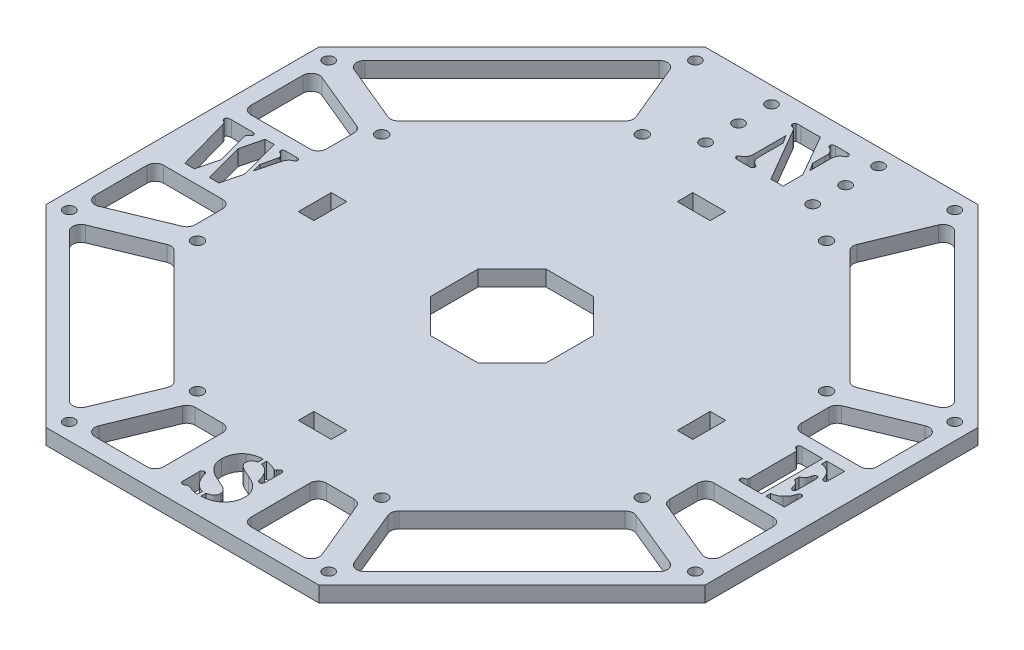
from build123d import *

# Parameters (mm, degrees)
BASE_DEPTH                   = 5.999988
SUPPORT_CUTOUTS_REACH        = 181.705
SKETCH4_W                    = 12.7
SKETCH4_H                    = 5.999988
SUPPORT_CUTOUT_PATTERN_COUNT = 4
F_8_CLEARANCE_HOLE1_D        = 4.4958
MOTOR_WIRE_HOLES_DEPTH       = 180.705313934
MOUNT_CLEARANCE_HOLES_D      = 4.3053
MOUNT_CLEARANCE_HOLES_DEPTH  = 6.35
F_8_CLEARANCE_HOLE2_D        = 4.3053
LIGHTENNING_1_DEPTH          = 180.705313934
DIRECTIONS_DEPTH             = 180.705313934
LIGHTENNING_2_DEPTH          = 180.705314078
LIGHTENNING_2_CIRC_PAT_COUNT = 3
LIGHTENNING_2_CIRC_PAT_ANGLE = 180


with BuildPart() as part:
    # Base sketch → Base (new body)
    with BuildSketch(Plane(origin=(0, 0, 0), x_dir=(1, 0, 0), z_dir=(0, 1, 0))):
        Polygon((-127, 52.605122421), (-127, -52.605122421), (-52.605122421, -127), (52.605122421, -127), (127, -52.605122421), (127, 52.605122421), (52.605122421, 127), (-52.605122421, 127), align=None)
    extrude(amount=BASE_DEPTH)

    # Sketch4 → Support cutouts (cut, up to next)
    with BuildSketch(Plane(origin=(0, 5.999988, 0), x_dir=(1, 0, 0), z_dir=(0, 1, 0)), mode=Mode.PRIVATE) as support_cutouts_sk1:
        with Locations((0, 73.025)):
            Rectangle(SKETCH4_W, SKETCH4_H)
    support_cutouts_tool1 = extrude(support_cutouts_sk1.sketch, amount=-SUPPORT_CUTOUTS_REACH, mode=Mode.PRIVATE) & part.part
    support_cutouts = support_cutouts_tool1.solids().sort_by_distance((0, 5.999988, -73.025))[0]
    add(support_cutouts, mode=Mode.SUBTRACT)

    # Support cutout pattern: Support cutouts ×4 about axis
    support_cutout_pattern_axis = Axis((0, -0.29972, 0), (0, 1, 0))
    for i in range(1, SUPPORT_CUTOUT_PATTERN_COUNT):
        add(support_cutouts.rotate(support_cutout_pattern_axis, i * 360 / SUPPORT_CUTOUT_PATTERN_COUNT), mode=Mode.SUBTRACT)

    # #8 Clearance Hole1 (through all)
    with Locations(Plane(origin=(0, 5.999988, 0), x_dir=(1, 0, 0), z_dir=(0, 1, 0))):
        with Locations((-85.725, 35.508457634), (-35.508457634, 85.725), (35.508457634, 85.725), (85.725, 35.508457634), (85.725, -35.508457634), (35.508457634, -85.725), (-35.508457634, -85.725), (-85.725, -35.508457634)):
            Hole(F_8_CLEARANCE_HOLE1_D / 2)

    # Sketch29 → Motor wire holes (cut, through all)
    with BuildSketch(Plane(origin=(0, 5.999988, 0), x_dir=(1, 0, 0), z_dir=(0, 1, 0))):
        Polygon((-22.225, -9.205896424), (-9.205896424, -22.225), (9.205896424, -22.225), (22.225, -9.205896424), (22.225, 9.205896424), (9.205896424, 22.225), (-9.205896424, 22.225), (-22.225, 9.205896424), align=None)
    extrude(amount=-MOTOR_WIRE_HOLES_DEPTH, mode=Mode.SUBTRACT)

    # mount clearance holes
    with Locations(Plane(origin=(0, 5.999988, 0), x_dir=(1, 0, 0), z_dir=(0, 1, 0))):
        with Locations((-120.65, 49.9748663), (-49.9748663, 120.65), (49.9748663, 120.65), (120.65, 49.9748663), (120.65, -49.9748663), (49.9748663, -120.65), (-49.9748663, -120.65), (-120.65, -49.9748663)):
            Hole(MOUNT_CLEARANCE_HOLES_D / 2, depth=MOUNT_CLEARANCE_HOLES_DEPTH)

    # #8 Clearance Hole2 (through all)
    with Locations(Plane(origin=(0, 5.999988, 0), x_dir=(1, 0, 0), z_dir=(0, 1, 0))):
        with Locations((20.6375, 95.25), (20.6375, 107.95), (20.6375, 120.65), (-20.6375, 120.65), (-20.6375, 107.95), (-20.6375, 95.25)):
            Hole(F_8_CLEARANCE_HOLE2_D / 2)

    # Sketch36 → Lightenning 1 (cut, through all)
    with BuildSketch(Plane(origin=(0, 5.999988, 0), x_dir=(1, 0, 0), z_dir=(0, 1, 0))):
        with BuildLine():
            Line((-112.614920409, 51.801520213), (-90.389920409, 42.595623789))
            ThreePointArc((-90.389920409, 42.595623789), (-88.555488739, 42.41494804), (-86.929836481, 43.283877275))
            Line((-86.929836481, 43.283877275), (-43.283877275, 86.929836481))
            ThreePointArc((-43.283877275, 86.929836481), (-42.41494804, 88.555488739), (-42.595623789, 90.389920409))
            Line((-42.595623789, 90.389920409), (-51.801520213, 112.614920409))
            ThreePointArc((-51.801520213, 112.614920409), (-54.115425956, 114.513893776), (-56.979901759, 113.644964541))
            Line((-56.979901759, 113.644964541), (-113.644964541, 56.979901759))
            ThreePointArc((-113.644964541, 56.979901759), (-114.513893776, 54.115425956), (-112.614920409, 51.801520213))
        make_face()
        with BuildLine():
            Line((56.979901759, 113.644964541), (113.644964541, 56.979901759))
            ThreePointArc((113.644964541, 56.979901759), (114.513893776, 54.115425956), (112.614920409, 51.801520213))
            Line((112.614920409, 51.801520213), (90.389920409, 42.595623789))
            ThreePointArc((90.389920409, 42.595623789), (88.555488739, 42.41494804), (86.929836481, 43.283877275))
            Line((86.929836481, 43.283877275), (43.283877275, 86.929836481))
            ThreePointArc((43.283877275, 86.929836481), (42.41494804, 88.555488739), (42.595623789, 90.389920409))
            Line((42.595623789, 90.389920409), (51.801520213, 112.614920409))
            ThreePointArc((51.801520213, 112.614920409), (54.115425956, 114.513893776), (56.979901759, 113.644964541))
        make_face()
        with BuildLine():
            Line((113.644964541, -56.979901759), (56.979901759, -113.644964541))
            ThreePointArc((56.979901759, -113.644964541), (54.115425956, -114.513893776), (51.801520213, -112.614920409))
            Line((51.801520213, -112.614920409), (42.595623789, -90.389920409))
            ThreePointArc((42.595623789, -90.389920409), (42.41494804, -88.555488739), (43.283877275, -86.929836481))
            Line((43.283877275, -86.929836481), (86.929836481, -43.283877275))
            ThreePointArc((86.929836481, -43.283877275), (88.555488739, -42.41494804), (90.389920409, -42.595623789))
            Line((90.389920409, -42.595623789), (112.614920409, -51.801520213))
            ThreePointArc((112.614920409, -51.801520213), (114.513893776, -54.115425956), (113.644964541, -56.979901759))
        make_face()
        with BuildLine():
            Line((-56.979901759, -113.644964541), (-113.644964541, -56.979901759))
            ThreePointArc((-113.644964541, -56.979901759), (-114.513893776, -54.115425956), (-112.614920409, -51.801520213))
            Line((-112.614920409, -51.801520213), (-90.389920409, -42.595623789))
            ThreePointArc((-90.389920409, -42.595623789), (-88.555488739, -42.41494804), (-86.929836481, -43.283877275))
            Line((-86.929836481, -43.283877275), (-43.283877275, -86.929836481))
            ThreePointArc((-43.283877275, -86.929836481), (-42.41494804, -88.555488739), (-42.595623789, -90.389920409))
            Line((-42.595623789, -90.389920409), (-51.801520213, -112.614920409))
            ThreePointArc((-51.801520213, -112.614920409), (-54.115425956, -114.513893776), (-56.979901759, -113.644964541))
        make_face()
    extrude(amount=-LIGHTENNING_1_DEPTH, mode=Mode.SUBTRACT)

    # Sketch37 → Directions (cut, through all)
    with BuildSketch(Plane(origin=(0, 5.999988, 0), x_dir=(1, 0, 0), z_dir=(0, 1, 0))):
        with BuildLine():
            Line((-0.263655027, 119.115560665), (8.895510373, 103.159733252))
            Line((8.895510373, 103.159733252), (8.895510373, 95.602783972))
            Line((8.895510373, 95.602783972), (4.196016594, 95.602783972))
            Line((4.196016594, 95.602783972), (-7.565474351, 115.758050452))
            add(Edge.make_bspline(
                [(-7.565474351, 115.758050452), (-7.626545799, 115.858484028), (-7.740071239, 116.045179551), (-7.898822848, 116.301319094), (-8.049204258, 116.502903942), (-8.222803652, 116.707787914), (-8.466187591, 116.913139143), (-8.696438169, 117.002669141), (-8.815611133, 117.049008026)],
                knots=[0, 0, 0, 0, 1.148206832, 2.134396517, 2.941784819, 3.601293645, 4.758478929, 6, 6, 6, 6], degree=3))
            Line((-8.815611133, 117.049008026), (-9.473846418, 117.288830184))
            add(Edge.make_bspline(
                [(-9.473846418, 117.288830184), (-9.55527066, 117.324691169), (-9.717709786, 117.396232848), (-9.904505623, 117.592550574), (-10.019149579, 117.836024562), (-10.036623424, 118.012257311), (-10.045337518, 118.100143443)],
                knots=[0, 0, 0, 0, 1.002473422, 1.999906911, 3.00256651, 4, 4, 4, 4], degree=3))
            add(Edge.make_bspline(
                [(-10.045337518, 118.100143443), (-10.037149376, 118.195015854), (-10.020718931, 118.385388219), (-9.897734175, 118.647272373), (-9.71184523, 118.871275333), (-9.539105479, 118.952710769), (-9.453436021, 118.993098287)],
                knots=[0, 0, 0, 0, 0.998849935, 2.004306838, 3.010245474, 4, 4, 4, 4], degree=3))
            add(Edge.make_bspline(
                [(-9.453436021, 118.993098287), (-9.382409116, 119.013998559), (-9.199550463, 119.067806278), (-8.849403273, 119.086590792), (-8.374085078, 119.118367463), (-8.012973394, 119.116569356), (-7.810399108, 119.115560665)],
                knots=[0, 0, 0, 0, 0.536148819, 1.380314255, 2.53042427, 4, 4, 4, 4], degree=3))
            Line((-7.810399108, 119.115560665), (-0.263655027, 119.115560665))
        make_face()
        with BuildLine():
            Line((-7.432806774, 112.977133937), (-5.473408717, 109.961497864))
            Line((-5.473408717, 109.961497864), (-5.473408717, 100.776819469))
            add(Edge.make_bspline(
                [(-5.473408717, 100.776819469), (-5.469055935, 100.586021928), (-5.460700363, 100.21976823), (-5.382728119, 99.6981249), (-5.262710119, 99.227406629), (-5.089068936, 98.805729823), (-4.85213913, 98.431592131), (-4.564343169, 98.090725132), (-4.214003136, 97.787147282), (-3.946837055, 97.621522578), (-3.809961407, 97.536669035)],
                knots=[0, 0, 0, 0, 1.190721145, 2.285700438, 3.285246989, 4.21825195, 5.120024924, 6.039327733, 6.995500152, 8, 8, 8, 8], degree=3))
            Line((-3.809961407, 97.536669035), (-3.299701496, 97.245820885))
            add(Edge.make_bspline(
                [(-3.299701496, 97.245820885), (-3.231857884, 97.201860435), (-3.100479182, 97.116731315), (-2.959354433, 96.929548908), (-2.872470899, 96.712152954), (-2.86483304, 96.556123983), (-2.860877973, 96.47532842)],
                knots=[0, 0, 0, 0, 1.033525086, 2.00141443, 2.965084209, 4, 4, 4, 4], degree=3))
            add(Edge.make_bspline(
                [(-2.860877973, 96.47532842), (-2.864956803, 96.411995733), (-2.872848076, 96.28946659), (-2.93060722, 96.112330477), (-3.036684603, 95.957436924), (-3.129500678, 95.871499071), (-3.177239118, 95.827298333)],
                knots=[0, 0, 0, 0, 1.017932389, 1.969384057, 2.955585702, 4, 4, 4, 4], degree=3))
            add(Edge.make_bspline(
                [(-3.177239118, 95.827298333), (-3.232072148, 95.792158738), (-3.358904473, 95.710878595), (-3.60964788, 95.649789644), (-3.924156844, 95.610370207), (-4.156704558, 95.605474468), (-4.284503124, 95.602783972)],
                knots=[0, 0, 0, 0, 0.677978509, 1.568207904, 2.663588058, 4, 4, 4, 4], degree=3))
            Line((-4.284503124, 95.602783972), (-8.397198006, 95.602783972))
            add(Edge.make_bspline(
                [(-8.397198006, 95.602783972), (-8.526583167, 95.6057372), (-8.7673749, 95.611233293), (-9.104615381, 95.650410986), (-9.390388373, 95.718713479), (-9.626206962, 95.817067881), (-9.817639262, 95.936422178), (-9.951644061, 96.097510927), (-10.032074991, 96.288123463), (-10.040832926, 96.425222666), (-10.045337518, 96.495738816)],
                knots=[0, 0, 0, 0, 1.481402756, 2.756958638, 3.881237287, 4.832623133, 5.67532584, 6.435925958, 7.195527913, 8, 8, 8, 8], degree=3))
            add(Edge.make_bspline(
                [(-10.045337518, 96.495738816), (-10.040152027, 96.59001324), (-10.030404998, 96.767218379), (-9.903412197, 96.961501544), (-9.760252857, 97.097334013), (-9.59197636, 97.203111948), (-9.385634761, 97.33974442), (-9.224767325, 97.424262529), (-9.137074877, 97.470335246)],
                knots=[0, 0, 0, 0, 1.181703852, 2.22121744, 2.84898449, 3.689607338, 4.740553118, 6, 6, 6, 6], degree=3))
            add(Edge.make_bspline(
                [(-9.137074877, 97.470335246), (-9.001741347, 97.549749907), (-8.735097603, 97.706218319), (-8.383480555, 98.008009414), (-8.08712602, 98.356551203), (-7.8415043, 98.750980375), (-7.66103498, 99.1938922), (-7.527667687, 99.680178882), (-7.444771772, 100.212710799), (-7.436890013, 100.584308772), (-7.432806774, 100.776819469)],
                knots=[0, 0, 0, 0, 0.957876818, 1.887277031, 2.816677243, 3.745902915, 4.715393506, 5.729584291, 6.823784461, 8, 8, 8, 8], degree=3))
            Line((-7.432806774, 100.776819469), (-7.432806774, 112.977133937))
        make_face()
        with BuildLine():
            Line((8.895510373, 105.899828974), (6.936112316, 108.971593637))
            Line((6.936112316, 108.971593637), (6.936112316, 113.727216006))
            add(Edge.make_bspline(
                [(6.936112316, 113.727216006), (6.932370616, 113.958808382), (6.925354947, 114.393043082), (6.844437365, 115.002740085), (6.71114161, 115.525534451), (6.518028543, 115.977300644), (6.246621586, 116.364743581), (5.901854431, 116.717183716), (5.473651649, 117.039234765), (5.147590907, 117.219744535), (4.976714258, 117.31434318)],
                knots=[0, 0, 0, 0, 1.271815313, 2.384648193, 3.370695924, 4.228477648, 5.068356943, 5.953941433, 6.927734667, 8, 8, 8, 8], degree=3))
            add(Edge.make_bspline(
                [(4.976714258, 117.31434318), (4.868164473, 117.368374875), (4.676595176, 117.463730326), (4.449027176, 117.669039397), (4.342163456, 117.929734698), (4.330013976, 118.11121522), (4.323581572, 118.207298024)],
                knots=[0, 0, 0, 0, 1.226241823, 2.164078746, 3.027992319, 4, 4, 4, 4], degree=3))
            add(Edge.make_bspline(
                [(4.323581572, 118.207298024), (4.326975856, 118.280925883), (4.333427371, 118.420870337), (4.39560321, 118.613739811), (4.497218709, 118.775411138), (4.640205843, 118.907587108), (4.83086028, 119.004147112), (5.066805997, 119.067762156), (5.347898121, 119.107207651), (5.551458827, 119.112647635), (5.660462539, 119.115560665)],
                knots=[0, 0, 0, 0, 0.955472393, 1.816066146, 2.601729087, 3.415848399, 4.316465065, 5.352792599, 6.582460055, 8, 8, 8, 8], degree=3))
            Line((5.660462539, 119.115560665), (10.099723763, 119.115560665))
            add(Edge.make_bspline(
                [(10.099723763, 119.115560665), (10.231200093, 119.114693389), (10.470112236, 119.113117417), (10.789021961, 119.053755456), (11.046686526, 118.979509893), (11.168227766, 118.879435816), (11.222295567, 118.834917714)],
                knots=[0, 0, 0, 0, 1.33001182, 2.416830264, 3.295724593, 4, 4, 4, 4], degree=3))
            add(Edge.make_bspline(
                [(11.222295567, 118.834917714), (11.267367314, 118.787447308), (11.354058135, 118.696142915), (11.440780073, 118.529960918), (11.502163208, 118.356235674), (11.506074744, 118.233353879), (11.508041117, 118.17157983)],
                knots=[0, 0, 0, 0, 1.052575171, 2.024518947, 3.006903635, 4, 4, 4, 4], degree=3))
            add(Edge.make_bspline(
                [(11.508041117, 118.17157983), (11.503088142, 118.062665223), (11.494157556, 117.866284027), (11.377184755, 117.641680356), (11.227345989, 117.504126386), (11.056090138, 117.394165041), (10.837562827, 117.256760671), (10.666903244, 117.168405525), (10.57426548, 117.120444414)],
                knots=[0, 0, 0, 0, 1.290521724, 2.326907359, 2.91622468, 3.705360723, 4.754419484, 6, 6, 6, 6], degree=3))
            add(Edge.make_bspline(
                [(10.57426548, 117.120444414), (10.429053095, 117.037536479), (10.141124735, 116.873145918), (9.778542642, 116.526520488), (9.451861706, 116.135342779), (9.296322712, 115.828064847), (9.216974117, 115.671306267)],
                knots=[0, 0, 0, 0, 0.989285188, 1.961563128, 2.960086498, 4, 4, 4, 4], degree=3))
            add(Edge.make_bspline(
                [(9.216974117, 115.671306267), (9.16528334, 115.541568359), (9.05617796, 115.267726402), (8.969221397, 114.806746706), (8.904508661, 114.288690613), (8.898622194, 113.921387183), (8.895510373, 113.727216006)],
                knots=[0, 0, 0, 0, 0.843106883, 1.779572689, 2.826193964, 4, 4, 4, 4], degree=3))
            Line((8.895510373, 113.727216006), (8.895510373, 105.899828974))
        make_face()
        with BuildLine():
            Line((-0.165809003, -95.676400154), (-0.165809003, -97.676619004))
            add(Edge.make_bspline(
                [(-0.165809003, -97.676619004), (-0.342705037, -97.726235639), (-0.681805932, -97.821348259), (-1.142650012, -98.03451557), (-1.543202451, -98.277899915), (-1.873082632, -98.565569819), (-2.138002456, -98.890793734), (-2.313752552, -99.261205607), (-2.434916003, -99.660783521), (-2.446059136, -99.941230731), (-2.451773404, -100.085045784)],
                knots=[0, 0, 0, 0, 1.221315998, 2.341201987, 3.368653272, 4.331620241, 5.242373549, 6.138723041, 7.045525736, 8, 8, 8, 8], degree=3))
            add(Edge.make_bspline(
                [(-2.451773404, -100.085045784), (-2.445869196, -100.224988106), (-2.434372518, -100.497483908), (-2.344659545, -100.894135591), (-2.196307543, -101.262634831), (-1.987397074, -101.608450039), (-1.706737131, -101.930288608), (-1.356833038, -102.241583461), (-0.929569207, -102.541217947), (-0.612984525, -102.723928136), (-0.446451954, -102.820038906)],
                knots=[0, 0, 0, 0, 0.936089583, 1.822754381, 2.706490469, 3.585151587, 4.513803219, 5.553860443, 6.713260834, 8, 8, 8, 8], degree=3))
            add(Edge.make_bspline(
                [(-0.446451954, -102.820038906), (-0.376996981, -102.858000582), (-0.219421744, -102.944125733), (0.050894288, -103.073928874), (0.379479024, -103.22801943), (0.765379102, -103.403368433), (1.203780046, -103.612495034), (1.705847192, -103.827084946), (2.262552468, -104.074650787), (2.654118808, -104.245608896), (2.860032268, -104.335510841)],
                knots=[0, 0, 0, 0, 0.522083255, 1.184470872, 1.977560059, 2.916398476, 3.980628574, 5.181427924, 6.517794128, 8, 8, 8, 8], degree=3))
            add(Edge.make_bspline(
                [(2.860032268, -104.335510841), (3.10734466, -104.442848861), (3.575905103, -104.64621251), (4.229405861, -104.957547811), (4.796540752, -105.250292093), (5.435509407, -105.626661316), (6.161643774, -106.146739124), (6.664460458, -106.643085234), (6.921701159, -106.897015594)],
                knots=[0, 0, 0, 0, 1.002664352, 1.899657555, 2.691938798, 3.375452079, 4.657282928, 6, 6, 6, 6], degree=3))
            add(Edge.make_bspline(
                [(6.921701159, -106.897015594), (7.085130862, -107.076061186), (7.407840771, -107.429606382), (7.825372823, -108.005734447), (8.187472032, -108.601818532), (8.472629673, -109.230448218), (8.697633412, -109.879730921), (8.863039803, -110.553926923), (8.962009758, -111.255069027), (8.972654046, -111.732260028), (8.9780486, -111.974101707)],
                knots=[0, 0, 0, 0, 1.034400775, 2.042537998, 3.032752643, 4.007694519, 4.983852961, 5.96324819, 6.967768718, 8, 8, 8, 8], degree=3))
            add(Edge.make_bspline(
                [(8.9780486, -111.974101707), (8.964578358, -112.337477438), (8.938039256, -113.053401168), (8.71889728, -114.101934123), (8.373813733, -115.105303795), (7.879366934, -116.048248439), (7.270634211, -116.919911591), (6.546962761, -117.697820759), (5.722531129, -118.381663053), (5.102339157, -118.741788291), (4.788814731, -118.923841693)],
                knots=[0, 0, 0, 0, 1.021726653, 2.013008284, 3.001500974, 3.999129692, 4.999052287, 5.98466679, 6.981192572, 8, 8, 8, 8], degree=3))
            add(Edge.make_bspline(
                [(4.788814731, -118.923841693), (4.611264477, -119.012830555), (4.250956564, -119.193418252), (3.685985162, -119.424841418), (3.097004586, -119.630627177), (2.491691596, -119.800754087), (1.885571133, -119.938917476), (1.292257471, -120.034188773), (0.720135172, -120.100604018), (0.344626645, -120.108755754), (0.16075734, -120.112747285)],
                knots=[0, 0, 0, 0, 0.988584579, 2.006163536, 3.03732575, 4.093604654, 5.135285673, 6.130774793, 7.084726137, 8, 8, 8, 8], degree=3))
            Line((0.16075734, -120.112747285), (0.16075734, -118.158451826))
            add(Edge.make_bspline(
                [(0.16075734, -118.158451826), (0.403804689, -118.097084484), (0.860505192, -117.981771579), (1.480511441, -117.745451506), (2.000998006, -117.486785204), (2.412932071, -117.174576629), (2.727031599, -116.812005698), (2.94395881, -116.390505535), (3.08141839, -115.915026204), (3.093571737, -115.577521706), (3.099854426, -115.403048308)],
                knots=[0, 0, 0, 0, 1.35896739, 2.553580996, 3.593739597, 4.501887768, 5.339697937, 6.17353428, 7.055806124, 8, 8, 8, 8], degree=3))
            add(Edge.make_bspline(
                [(3.099854426, -115.403048308), (3.087050338, -115.214179856), (3.061555371, -114.838112881), (2.854111285, -114.297436242), (2.518336932, -113.794434416), (2.213641511, -113.514134926), (2.053821609, -113.367111263)],
                knots=[0, 0, 0, 0, 0.956506711, 1.904556217, 2.900890541, 4, 4, 4, 4], degree=3))
            add(Edge.make_bspline(
                [(2.053821609, -113.367111263), (1.989815767, -113.316930764), (1.853393106, -113.209975568), (1.619111461, -113.055967004), (1.344791046, -112.896014624), (1.034688212, -112.72184186), (0.683788864, -112.542076343), (0.292695955, -112.356456246), (-0.135739283, -112.154833794), (-0.437512811, -112.025858016), (-0.594427328, -111.958793909)],
                knots=[0, 0, 0, 0, 0.648896759, 1.383064736, 2.23514521, 3.183146396, 4.221327961, 5.380997987, 6.638185931, 8, 8, 8, 8], degree=3))
            add(Edge.make_bspline(
                [(-0.594427328, -111.958793909), (-0.766490903, -111.884580254), (-1.095865551, -111.742515924), (-1.565658652, -111.528120009), (-2.000590258, -111.346254266), (-2.384739266, -111.160878661), (-2.735391976, -111.014506176), (-3.035495935, -110.865590472), (-3.300322229, -110.747577504), (-3.726734725, -110.538228832), (-4.31980512, -110.209725292), (-4.808548329, -109.869350833), (-5.054098949, -109.698342504)],
                knots=[0, 0, 0, 0, 1.121856981, 2.147527434, 3.091543735, 3.943587412, 4.700435388, 5.36546554, 5.948667186, 6.435970719, 8.209387708, 10, 10, 10, 10], degree=3))
            add(Edge.make_bspline(
                [(-5.054098949, -109.698342504), (-5.313642587, -109.502975742), (-5.821312905, -109.120836123), (-6.492460938, -108.469705339), (-7.061806953, -107.770311688), (-7.523922307, -107.017792018), (-7.889559999, -106.220216668), (-8.144906399, -105.372153301), (-8.302422921, -104.477465218), (-8.320656258, -103.863332905), (-8.329967577, -103.549710578)],
                knots=[0, 0, 0, 0, 1.072629812, 2.098076158, 3.081155049, 4.045090279, 5.008386299, 5.971993782, 6.964346906, 8, 8, 8, 8], degree=3))
            add(Edge.make_bspline(
                [(-8.329967577, -103.549710578), (-8.320545622, -103.227608935), (-8.3019902, -102.59326797), (-8.143271935, -101.661846922), (-7.888161215, -100.767743433), (-7.531353155, -99.918595728), (-7.085944775, -99.124793509), (-6.542516403, -98.413987434), (-5.932801219, -97.768638102), (-5.459480123, -97.418309982), (-5.22248472, -97.24289808)],
                knots=[0, 0, 0, 0, 1.056681967, 2.081009744, 3.091782246, 4.102755181, 5.097879215, 6.070461086, 7.033865475, 8, 8, 8, 8], degree=3))
            add(Edge.make_bspline(
                [(-5.22248472, -97.24289808), (-5.048930425, -97.129632673), (-4.699433962, -96.901543478), (-4.141187358, -96.606645523), (-3.552805436, -96.350426484), (-2.932535948, -96.137636568), (-2.285383857, -95.958339564), (-1.606887438, -95.820624725), (-0.897837006, -95.722683024), (-0.412718479, -95.69201114), (-0.165809003, -95.676400154)],
                knots=[0, 0, 0, 0, 0.927145534, 1.867047348, 2.821631238, 3.796636345, 4.799446147, 5.825081488, 6.893037554, 8, 8, 8, 8], degree=3))
        make_face()
        with BuildLine():
            Line((1.140456369, -97.676619004), (1.140456369, -95.763144339))
            add(Edge.make_bspline(
                [(1.140456369, -95.763144339), (1.305629221, -95.776682379), (1.624983499, -95.802857571), (2.084918334, -95.869581803), (2.511202839, -95.955351541), (2.921124243, -96.06873347), (3.357047076, -96.212748233), (3.847678419, -96.416463475), (4.420799311, -96.664966056), (4.823522655, -96.858682825), (5.038842088, -96.962255129)],
                knots=[0, 0, 0, 0, 0.967485975, 1.870590603, 2.71201151, 3.504661189, 4.352621131, 5.390918259, 6.60503244, 8, 8, 8, 8], degree=3))
            add(Edge.make_bspline(
                [(5.038842088, -96.962255129), (5.140982418, -97.007407476), (5.320910505, -97.086946827), (5.515850277, -97.110327574), (5.60012799, -97.120435701)],
                knots=[0, 0, 0, 0, 1.13534614, 2, 2, 2, 2], degree=3))
            add(Edge.make_bspline(
                [(5.60012799, -97.120435701), (5.649954386, -97.118072845), (5.747388884, -97.113452328), (5.881529774, -97.060708345), (5.996818026, -96.975374852), (6.048036273, -96.896246965), (6.074669707, -96.855100548)],
                knots=[0, 0, 0, 0, 1.041120632, 2.035890107, 2.978664937, 4, 4, 4, 4], degree=3))
            Line((6.074669707, -96.855100548), (6.452262041, -96.263199051))
            add(Edge.make_bspline(
                [(6.452262041, -96.263199051), (6.496625328, -96.194059045), (6.578975318, -96.065716914), (6.744538207, -95.924013338), (6.92207064, -95.826188292), (7.051477641, -95.818152255), (7.115599925, -95.81417033)],
                knots=[0, 0, 0, 0, 1.167643081, 2.167454281, 3.0919578, 4, 4, 4, 4], degree=3))
            add(Edge.make_bspline(
                [(7.115599925, -95.81417033), (7.187618553, -95.817177711), (7.324973347, -95.822913426), (7.514266689, -95.891058418), (7.670764126, -96.004825432), (7.796116001, -96.163260778), (7.884974112, -96.371499399), (7.958493439, -96.620900575), (7.987723116, -96.924241436), (7.994615593, -97.140855744), (7.998349571, -97.258205877)],
                knots=[0, 0, 0, 0, 0.897447072, 1.711621872, 2.473249793, 3.290475505, 4.204161629, 5.288175448, 6.530877421, 8, 8, 8, 8], degree=3))
            Line((7.998349571, -97.258205877), (7.998349571, -103.013937672))
            add(Edge.make_bspline(
                [(7.998349571, -103.013937672), (7.996688784, -103.104488389), (7.993487365, -103.279038717), (7.933134759, -103.525909931), (7.848439902, -103.750383437), (7.725153041, -103.942680241), (7.578694578, -104.10646903), (7.400469749, -104.217240353), (7.20553235, -104.297706454), (7.065438128, -104.302448134), (6.993137546, -104.304895246)],
                knots=[0, 0, 0, 0, 1.18556103, 2.285349829, 3.31800963, 4.321767828, 5.269816893, 6.174247696, 7.05775591, 8, 8, 8, 8], degree=3))
            add(Edge.make_bspline(
                [(6.993137546, -104.304895246), (6.881070938, -104.29507923), (6.651489418, -104.274969975), (6.462337989, -104.142887023), (6.365517856, -104.075278287)],
                knots=[0, 0, 0, 0, 0.976268549, 2, 2, 2, 2], degree=3))
            add(Edge.make_bspline(
                [(6.365517856, -104.075278287), (6.317665767, -104.024119962), (6.219707041, -103.91939299), (6.096139709, -103.710773903), (6.007049817, -103.411086554), (5.962999587, -103.177721201), (5.936899531, -103.039450667)],
                knots=[0, 0, 0, 0, 0.734618928, 1.503849384, 2.521014053, 4, 4, 4, 4], degree=3))
            add(Edge.make_bspline(
                [(5.936899531, -103.039450667), (5.862152732, -102.740564813), (5.707212188, -102.121012705), (5.301427801, -101.232737845), (4.828692028, -100.360826574), (4.421975489, -99.840353323), (4.22242623, -99.584991071)],
                knots=[0, 0, 0, 0, 0.948439242, 1.965993117, 3.002045587, 4, 4, 4, 4], degree=3))
            add(Edge.make_bspline(
                [(4.22242623, -99.584991071), (4.011997709, -99.355888702), (3.596942244, -98.904000386), (2.848289295, -98.367066762), (2.033146711, -97.935290656), (1.440311973, -97.763507078), (1.140456369, -97.676619004)],
                knots=[0, 0, 0, 0, 1.010958313, 1.994044201, 2.985388257, 4, 4, 4, 4], degree=3))
        make_face()
        with BuildLine():
            Line((-1.145508032, -118.158451826), (-1.145508032, -120.112747285))
            add(Edge.make_bspline(
                [(-1.145508032, -120.112747285), (-1.389314606, -120.10317083), (-1.890486765, -120.083485335), (-2.657175925, -119.940111743), (-3.460469148, -119.722712735), (-3.996153344, -119.515719651), (-4.273401286, -119.408588608)],
                knots=[0, 0, 0, 0, 0.90692939, 1.864296574, 2.894648409, 4, 4, 4, 4], degree=3))
            add(Edge.make_bspline(
                [(-4.273401286, -119.408588608), (-4.372084227, -119.369537561), (-4.55241572, -119.298176355), (-4.79635378, -119.200533857), (-4.991236393, -119.12642115), (-5.183409475, -119.067959567), (-5.386097315, -119.013207778), (-5.54356042, -119.004590544), (-5.62048745, -119.000380679)],
                knots=[0, 0, 0, 0, 1.349771181, 2.466548425, 3.342620573, 3.999496596, 5.022674002, 6, 6, 6, 6], degree=3))
            add(Edge.make_bspline(
                [(-5.62048745, -119.000380679), (-5.72128558, -119.000708661), (-5.896162767, -119.001277684), (-6.149760776, -119.066121723), (-6.405503893, -119.209765023), (-6.580110954, -119.339453828), (-6.686930664, -119.418793806)],
                knots=[0, 0, 0, 0, 1.025725037, 1.779555911, 2.641594495, 4, 4, 4, 4], degree=3))
            add(Edge.make_bspline(
                [(-6.686930664, -119.418793806), (-6.790848061, -119.485966217), (-6.996427968, -119.618853476), (-7.240015744, -119.64204486), (-7.360473746, -119.653513365)],
                knots=[0, 0, 0, 0, 1.010968418, 2, 2, 2, 2], degree=3))
            add(Edge.make_bspline(
                [(-7.360473746, -119.653513365), (-7.437452723, -119.649847343), (-7.581839136, -119.642971132), (-7.784378508, -119.585011016), (-7.958056813, -119.488775615), (-8.09272912, -119.342520359), (-8.201888076, -119.166477921), (-8.277730071, -118.950960907), (-8.322751993, -118.697808719), (-8.327455905, -118.515844735), (-8.329967577, -118.418684381)],
                knots=[0, 0, 0, 0, 1.030217647, 1.932338358, 2.800681709, 3.655444571, 4.566741571, 5.56230499, 6.698383569, 8, 8, 8, 8], degree=3))
            Line((-8.329967577, -118.418684381), (-8.329967577, -112.178205671))
            add(Edge.make_bspline(
                [(-8.329967577, -112.178205671), (-8.3280666, -112.111350776), (-8.32428966, -111.978520694), (-8.262922329, -111.792091278), (-8.182642467, -111.615161342), (-8.058368506, -111.464963689), (-7.911012751, -111.338639206), (-7.746168201, -111.236075515), (-7.557467615, -111.181744064), (-7.427084896, -111.169198066), (-7.360473746, -111.162788448)],
                knots=[0, 0, 0, 0, 1.025048767, 2.036609463, 2.997690381, 4.004487562, 5.007868388, 5.983135769, 6.96960544, 8, 8, 8, 8], degree=3))
            add(Edge.make_bspline(
                [(-7.360473746, -111.162788448), (-7.245372002, -111.167321716), (-7.027692041, -111.175895013), (-6.790879891, -111.333023835), (-6.650544016, -111.510528177), (-6.556202024, -111.691660095), (-6.469698546, -111.914638481), (-6.421913782, -112.079097809), (-6.396082515, -112.168000473)],
                knots=[0, 0, 0, 0, 1.332817487, 2.520619119, 3.18935181, 3.986203612, 4.911391244, 6, 6, 6, 6], degree=3))
            add(Edge.make_bspline(
                [(-6.396082515, -112.168000473), (-6.326223918, -112.405491782), (-6.186905498, -112.879118727), (-5.92016086, -113.568036632), (-5.605955558, -114.232485411), (-5.259188203, -114.873547746), (-4.865686641, -115.47395522), (-4.441251901, -116.031483739), (-3.989831694, -116.546088418), (-3.657153463, -116.849954459), (-3.492703622, -117.000161829)],
                knots=[0, 0, 0, 0, 1.039224005, 2.072515798, 3.098176232, 4.124234497, 5.130614068, 6.109159237, 7.065317673, 8, 8, 8, 8], degree=3))
            add(Edge.make_bspline(
                [(-3.492703622, -117.000161829), (-3.321424463, -117.143390775), (-2.980878047, -117.428166253), (-2.404771932, -117.75579372), (-1.792725309, -118.009668724), (-1.363365759, -118.108370425), (-1.145508032, -118.158451826)],
                knots=[0, 0, 0, 0, 1.009633933, 2.007408369, 2.988955799, 4, 4, 4, 4], degree=3))
        make_face()
        with BuildLine():
            Line((107.444627345, 12.245606487), (107.444627345, -11.267170205))
            Line((107.444627345, -11.267170205), (99.91829366, -11.267170205))
            Line((99.91829366, -11.267170205), (99.469264938, -11.267170205))
            add(Edge.make_bspline(
                [(99.469264938, -11.267170205), (99.380630348, -11.264237394), (99.214219406, -11.258731056), (98.978565467, -11.217949445), (98.772760595, -11.149367753), (98.601651414, -11.045325462), (98.461442111, -10.916431013), (98.37243214, -10.75406898), (98.310948611, -10.572446643), (98.304293129, -10.442832555), (98.300769742, -10.374215361)],
                knots=[0, 0, 0, 0, 1.275809178, 2.395324508, 3.433364274, 4.378530456, 5.262016052, 6.140052186, 7.015350866, 8, 8, 8, 8], degree=3))
            add(Edge.make_bspline(
                [(98.300769742, -10.374215361), (98.307711752, -10.265781859), (98.320769422, -10.061822368), (98.443261593, -9.783531621), (98.657328733, -9.570967071), (98.841394014, -9.492226171), (98.938594631, -9.450644923)],
                knots=[0, 0, 0, 0, 1.074896783, 2.021841926, 2.955380476, 4, 4, 4, 4], degree=3))
            add(Edge.make_bspline(
                [(98.938594631, -9.450644923), (99.018649585, -9.422063931), (99.158507597, -9.372132221), (99.339560634, -9.303020445), (99.466577609, -9.258912406), (99.569488747, -9.219274176), (99.663140661, -9.144399091), (99.711762722, -9.066684291), (99.739702691, -9.022026598)],
                knots=[0, 0, 0, 0, 1.641128884, 2.867093284, 3.73955991, 4.239698614, 4.988468111, 6, 6, 6, 6], degree=3))
            add(Edge.make_bspline(
                [(99.739702691, -9.022026598), (99.77097297, -8.970367618), (99.838332998, -8.85908782), (99.894021861, -8.655874204), (99.930676266, -8.416236955), (99.932573427, -8.243230547), (99.933601457, -8.14948215)],
                knots=[0, 0, 0, 0, 0.795728394, 1.714096871, 2.761318972, 4, 4, 4, 4], degree=3))
            Line((99.933601457, -8.14948215), (99.933601457, 9.066687243))
            add(Edge.make_bspline(
                [(99.933601457, 9.066687243), (99.93235509, 9.162090055), (99.930029795, 9.340079037), (99.895506026, 9.585298987), (99.837101563, 9.792643824), (99.77085942, 9.906221349), (99.739702691, 9.959642087)],
                knots=[0, 0, 0, 0, 1.234380862, 2.302932019, 3.201790819, 4, 4, 4, 4], degree=3))
            add(Edge.make_bspline(
                [(99.739702691, 9.959642087), (99.711747842, 10.004260542), (99.663099885, 10.08190706), (99.569588322, 10.15715223), (99.465697399, 10.195916596), (99.341061364, 10.247987491), (99.158137439, 10.313875793), (99.018514837, 10.364427265), (98.938594631, 10.393363011)],
                knots=[0, 0, 0, 0, 1.009569614, 1.75688657, 2.256055053, 3.138468602, 4.362054748, 6, 6, 6, 6], degree=3))
            add(Edge.make_bspline(
                [(98.938594631, 10.393363011), (98.840839551, 10.434398999), (98.653456303, 10.513059429), (98.444681894, 10.737053718), (98.320494562, 11.019693241), (98.30761491, 11.227108543), (98.300769742, 11.337343846)],
                knots=[0, 0, 0, 0, 1.03007389, 1.974512116, 2.923511095, 4, 4, 4, 4], degree=3))
            add(Edge.make_bspline(
                [(98.300769742, 11.337343846), (98.30437558, 11.407611161), (98.311192768, 11.540458392), (98.371218007, 11.726123912), (98.461586913, 11.88963688), (98.601489104, 12.019027172), (98.773816411, 12.121496316), (98.977349465, 12.19804784), (99.214411777, 12.236640485), (99.380697201, 12.242490581), (99.469264938, 12.245606487)],
                knots=[0, 0, 0, 0, 1.002003185, 1.894384998, 2.766311233, 3.643649008, 4.582238159, 5.621343591, 6.733068665, 8, 8, 8, 8], degree=3))
            Line((99.469264938, 12.245606487), (99.91829366, 12.245606487))
            Line((99.91829366, 12.245606487), (107.444627345, 12.245606487))
        make_face()
        with BuildLine():
            Line((109.07745906, 12.245606487), (115.935352262, 12.245606487))
            Line((115.935352262, 12.245606487), (115.935352262, 6.056153769))
            add(Edge.make_bspline(
                [(115.935352262, 6.056153769), (115.93501717, 5.974182618), (115.934397551, 5.822609776), (115.889303067, 5.614269738), (115.833350205, 5.435760599), (115.738812275, 5.293732328), (115.615650251, 5.185439987), (115.462606166, 5.11639258), (115.283521105, 5.06726771), (115.153363518, 5.063290412), (115.083218211, 5.061146942)],
                knots=[0, 0, 0, 0, 1.297100046, 2.398467488, 3.37194797, 4.248080405, 5.071011418, 5.940462097, 6.890061477, 8, 8, 8, 8], degree=3))
            add(Edge.make_bspline(
                [(115.083218211, 5.061146942), (114.975639172, 5.067764874), (114.784726323, 5.079509245), (114.555347519, 5.174960775), (114.448171062, 5.323711588), (114.36429782, 5.464189313), (114.28555902, 5.646516998), (114.240132881, 5.783633489), (114.215776362, 5.857152403)],
                knots=[0, 0, 0, 0, 1.496408907, 2.655570162, 3.259085196, 3.998612629, 4.926899124, 6, 6, 6, 6], degree=3))
            add(Edge.make_bspline(
                [(114.215776362, 5.857152403), (114.102689553, 6.176667342), (113.885686621, 6.789786402), (113.448178477, 7.628146972), (112.931870515, 8.344795566), (112.333499426, 8.945879906), (111.651397448, 9.432966082), (110.874846328, 9.801397966), (110.010633833, 10.071314543), (109.395662192, 10.155766496), (109.07745906, 10.199464245)],
                knots=[0, 0, 0, 0, 1.130832012, 2.169960077, 3.145894403, 4.069657363, 4.990096479, 5.930045021, 6.928948727, 8, 8, 8, 8], degree=3))
            Line((109.07745906, 10.199464245), (109.07745906, 12.245606487))
        make_face()
        with BuildLine():
            Line((109.07745906, -0.352710712), (109.07745906, 1.632200341))
            add(Edge.make_bspline(
                [(109.07745906, 1.632200341), (109.228015269, 1.713866996), (109.515805148, 1.869973719), (109.912886302, 2.119057681), (110.236667594, 2.395563589), (110.513534266, 2.678853338), (110.731883749, 3.005007654), (110.921224992, 3.366586563), (111.07377218, 3.778873799), (111.146887684, 4.07212954), (111.184832492, 4.224320689)],
                knots=[0, 0, 0, 0, 1.180986571, 2.257469038, 3.222785507, 4.110265038, 4.978639913, 5.917385587, 6.919184056, 8, 8, 8, 8], degree=3))
            add(Edge.make_bspline(
                [(111.184832492, 4.224320689), (111.206679239, 4.326890712), (111.246803598, 4.515273745), (111.330079845, 4.769405327), (111.416983415, 4.974571531), (111.523516771, 5.133734241), (111.650356742, 5.249252198), (111.795800191, 5.333894222), (111.966212538, 5.380117801), (112.086017933, 5.385090065), (112.149223723, 5.387713285)],
                knots=[0, 0, 0, 0, 1.505392146, 2.764846178, 3.836585285, 4.697326174, 5.492824879, 6.280783141, 7.092991927, 8, 8, 8, 8], degree=3))
            add(Edge.make_bspline(
                [(112.149223723, 5.387713285), (112.231864402, 5.384457962), (112.388931156, 5.3782709), (112.60071502, 5.28693367), (112.771179722, 5.140704469), (112.841939095, 5.01134776), (112.878895396, 4.943787163)],
                knots=[0, 0, 0, 0, 1.085852217, 2.06376913, 2.988742716, 4, 4, 4, 4], degree=3))
            add(Edge.make_bspline(
                [(112.878895396, 4.943787163), (112.897656352, 4.893204972), (112.942849626, 4.77135752), (112.968763611, 4.542762015), (112.998201064, 4.245543731), (112.996950783, 4.022080617), (112.996255175, 3.897754346)],
                knots=[0, 0, 0, 0, 0.609895254, 1.469176849, 2.591947466, 4, 4, 4, 4], degree=3))
            Line((112.996255175, 3.897754346), (112.996255175, -2.628469914))
            add(Edge.make_bspline(
                [(112.996255175, -2.628469914), (112.994457747, -2.754364412), (112.991147883, -2.986192167), (112.964145463, -3.304661004), (112.910135045, -3.560367746), (112.836117683, -3.762288661), (112.723144278, -3.909233522), (112.575668191, -4.011773101), (112.391920624, -4.073277734), (112.256884861, -4.079431905), (112.184941917, -4.08271066)],
                knots=[0, 0, 0, 0, 1.58411055, 2.917051989, 4.012593196, 4.866950163, 5.598911493, 6.305405458, 7.097171608, 8, 8, 8, 8], degree=3))
            add(Edge.make_bspline(
                [(112.184941917, -4.08271066), (112.06809723, -4.072590794), (111.84507069, -4.053274566), (111.602882811, -3.886579258), (111.471763551, -3.693659398), (111.381909854, -3.50889877), (111.298617581, -3.285348066), (111.257863967, -3.120556665), (111.235858483, -3.031575244)],
                knots=[0, 0, 0, 0, 1.342036637, 2.56160375, 3.240040044, 4.033620071, 4.938225671, 6, 6, 6, 6], degree=3))
            add(Edge.make_bspline(
                [(111.235858483, -3.031575244), (111.188884657, -2.843225629), (111.099139443, -2.483376793), (110.90774895, -1.989463115), (110.697863985, -1.557805675), (110.443415217, -1.200206809), (110.157621296, -0.902940057), (109.837813436, -0.658286586), (109.47435608, -0.471233305), (109.211664881, -0.392787662), (109.07745906, -0.352710712)],
                knots=[0, 0, 0, 0, 1.278531199, 2.442680666, 3.485773606, 4.434753066, 5.322955403, 6.195374153, 7.078038041, 8, 8, 8, 8], degree=3))
        make_face()
        with BuildLine():
            Line((109.07745906, -11.267170205), (109.07745906, -9.369003337))
            add(Edge.make_bspline(
                [(109.07745906, -9.369003337), (109.256319479, -9.338206454), (109.600267525, -9.27898414), (110.090515527, -9.169592244), (110.530732, -9.034629452), (110.935584605, -8.888558318), (111.309297417, -8.69628348), (111.681211672, -8.476080267), (112.050567345, -8.211893251), (112.288326279, -8.011667914), (112.409456278, -7.909659992)],
                knots=[0, 0, 0, 0, 1.178424117, 2.266106011, 3.258322885, 4.167001624, 5.056005255, 5.982165939, 6.971982955, 8, 8, 8, 8], degree=3))
            add(Edge.make_bspline(
                [(112.409456278, -7.909659992), (112.639289495, -7.695173596), (113.07808951, -7.285673895), (113.528064726, -6.686648428), (113.824277093, -6.175937008), (114.032581118, -5.740810733), (114.242123057, -5.255192552), (114.365807891, -4.906730174), (114.430085525, -4.725638148)],
                knots=[0, 0, 0, 0, 1.478913818, 2.823557948, 3.509390326, 4.258413643, 5.094916917, 6, 6, 6, 6], degree=3))
            add(Edge.make_bspline(
                [(114.430085525, -4.725638148), (114.461341608, -4.638506179), (114.519071808, -4.477572831), (114.613981107, -4.260353876), (114.715615023, -4.090744914), (114.850964982, -3.92072245), (115.082371304, -3.779539298), (115.290223568, -3.764209613), (115.399579355, -3.756144317)],
                knots=[0, 0, 0, 0, 1.119865357, 2.068399023, 2.86239926, 3.505232302, 4.687446157, 6, 6, 6, 6], degree=3))
            add(Edge.make_bspline(
                [(115.399579355, -3.756144317), (115.474597964, -3.760591298), (115.614695441, -3.768896047), (115.810078492, -3.815490783), (115.965241582, -3.912066536), (116.085296736, -4.04808947), (116.164221455, -4.232034382), (116.225347356, -4.4601525), (116.258116508, -4.741753584), (116.26058574, -4.946686546), (116.261918605, -5.05730709)],
                knots=[0, 0, 0, 0, 0.999578033, 1.866714988, 2.638932701, 3.392362113, 4.242509345, 5.27434009, 6.528718957, 8, 8, 8, 8], degree=3))
            Line((116.261918605, -5.05730709), (116.261918605, -11.267170205))
            Line((116.261918605, -11.267170205), (109.07745906, -11.267170205))
        make_face()
        with BuildLine():
            Line((-108.233737002, -3.784233821), (-110.315597439, -12.081059972))
            Line((-110.315597439, -12.081059972), (-114.035392189, -12.081059972))
            Line((-114.035392189, -12.081059972), (-119.689072001, 8.160950692))
            add(Edge.make_bspline(
                [(-119.689072001, 8.160950692), (-119.720431728, 8.266713505), (-119.777946303, 8.460685324), (-119.8696621, 8.721285075), (-119.953396374, 8.928337026), (-120.069758077, 9.134501373), (-120.285360776, 9.340059127), (-120.499622119, 9.435183893), (-120.617745039, 9.487626461)],
                knots=[0, 0, 0, 0, 1.167972537, 2.142092775, 2.924919439, 3.530384174, 4.638493406, 6, 6, 6, 6], degree=3))
            add(Edge.make_bspline(
                [(-120.617745039, 9.487626461), (-120.723644568, 9.534277512), (-120.922708786, 9.621969641), (-121.149049303, 9.839470942), (-121.29882403, 10.100828655), (-121.314026866, 10.295188128), (-121.321903716, 10.395889102)],
                knots=[0, 0, 0, 0, 1.124497015, 2.113768801, 3.022711285, 4, 4, 4, 4], degree=3))
            add(Edge.make_bspline(
                [(-121.321903716, 10.395889102), (-121.315931589, 10.474931113), (-121.304245452, 10.62959892), (-121.214670021, 10.845629147), (-121.061832069, 11.027157746), (-120.852235333, 11.175020586), (-120.590630756, 11.287745464), (-120.284165892, 11.376191389), (-119.930449275, 11.425077792), (-119.679010804, 11.429422052), (-119.546199226, 11.431716721)],
                knots=[0, 0, 0, 0, 0.825895137, 1.616094889, 2.400254808, 3.279859759, 4.275897844, 5.369034482, 6.610305417, 8, 8, 8, 8], degree=3))
            Line((-119.546199226, 11.431716721), (-111.489195234, 11.431716721))
            add(Edge.make_bspline(
                [(-111.489195234, 11.431716721), (-111.383634491, 11.428140361), (-111.188844746, 11.421540955), (-110.924023298, 11.391202403), (-110.709804741, 11.328333483), (-110.600122827, 11.255557327), (-110.550316998, 11.222510158)],
                knots=[0, 0, 0, 0, 1.295967113, 2.391429781, 3.269558928, 4, 4, 4, 4], degree=3))
            add(Edge.make_bspline(
                [(-110.550316998, 11.222510158), (-110.500528104, 11.178626254), (-110.40174646, 11.091560168), (-110.291621817, 10.924387), (-110.229163518, 10.728414375), (-110.222246833, 10.590242709), (-110.218648055, 10.518351481)],
                knots=[0, 0, 0, 0, 0.983124202, 1.950527883, 2.933652084, 4, 4, 4, 4], degree=3))
            add(Edge.make_bspline(
                [(-110.218648055, 10.518351481), (-110.22525178, 10.432014233), (-110.238469583, 10.259204359), (-110.356560605, 10.017854919), (-110.535241869, 9.794338944), (-110.698044078, 9.680906206), (-110.785036557, 9.620294037)],
                knots=[0, 0, 0, 0, 0.930220893, 1.861900385, 2.857518059, 4, 4, 4, 4], degree=3))
            add(Edge.make_bspline(
                [(-110.785036557, 9.620294037), (-110.854855622, 9.572865186), (-110.984021518, 9.485121385), (-111.159783817, 9.362177517), (-111.289059105, 9.241722462), (-111.421765647, 9.097183382), (-111.510329536, 8.850876827), (-111.519656474, 8.644601205), (-111.524913427, 8.528337828)],
                knots=[0, 0, 0, 0, 1.084177455, 2.005737993, 2.747551633, 3.35153173, 4.507240648, 6, 6, 6, 6], degree=3))
            add(Edge.make_bspline(
                [(-111.524913427, 8.528337828), (-111.521457548, 8.46518388), (-111.51449599, 8.337965936), (-111.487488021, 8.213449216), (-111.473887436, 8.150745494)],
                knots=[0, 0, 0, 0, 0.992846558, 2, 2, 2, 2], degree=3))
            Line((-111.473887436, 8.150745494), (-108.233737002, -3.784233821))
        make_face()
        Polygon((-106.595802688, 11.431716721), (-103.049496308, 11.431716721), (-98.91639103, -4.284288534), (-100.880891687, -12.081059972), (-104.631302032, -12.081059972), (-108.64704753, 2.981812597), align=None)
        with BuildLine():
            Line((-98.263258344, -1.539090213), (-99.156213188, 1.93577978))
            Line((-99.156213188, 1.93577978), (-97.957102397, 7.074097082))
            add(Edge.make_bspline(
                [(-97.957102397, 7.074097082), (-97.933967034, 7.169123992), (-97.890386788, 7.348126843), (-97.844944648, 7.600324392), (-97.817466695, 7.818495582), (-97.811755268, 7.9516851), (-97.809127023, 8.012975318)],
                knots=[0, 0, 0, 0, 1.232054524, 2.320829669, 3.227291176, 4, 4, 4, 4], degree=3))
            add(Edge.make_bspline(
                [(-97.809127023, 8.012975318), (-97.810992011, 8.096718497), (-97.814653801, 8.261143167), (-97.875082305, 8.496046888), (-97.960128427, 8.714859226), (-98.08802375, 8.91430706), (-98.255870384, 9.100835386), (-98.468160903, 9.278966052), (-98.724912278, 9.452865728), (-98.917030637, 9.55576959), (-99.018443012, 9.610088839)],
                knots=[0, 0, 0, 0, 0.942297429, 1.85014404, 2.71985303, 3.582543836, 4.507079092, 5.541809685, 6.702409717, 8, 8, 8, 8], degree=3))
            add(Edge.make_bspline(
                [(-99.018443012, 9.610088839), (-99.141855856, 9.678529527), (-99.356788076, 9.797723838), (-99.616660706, 10.018265853), (-99.748389009, 10.290218156), (-99.761566513, 10.47958489), (-99.768525081, 10.57958267)],
                knots=[0, 0, 0, 0, 1.299833306, 2.263751888, 3.083149647, 4, 4, 4, 4], degree=3))
            add(Edge.make_bspline(
                [(-99.768525081, 10.57958267), (-99.76379875, 10.64943799), (-99.75478569, 10.782651282), (-99.709690424, 10.970449185), (-99.60948798, 11.120643556), (-99.478463749, 11.243207806), (-99.300863517, 11.329949291), (-99.084202028, 11.386646147), (-98.826226913, 11.43039342), (-98.639377415, 11.431253663), (-98.538798696, 11.431716721)],
                knots=[0, 0, 0, 0, 0.979988515, 1.868826844, 2.660689651, 3.468822888, 4.351912292, 5.391040777, 6.595630283, 8, 8, 8, 8], degree=3))
            Line((-98.538798696, 11.431716721), (-94.436309012, 11.431716721))
            add(Edge.make_bspline(
                [(-94.436309012, 11.431716721), (-94.334066121, 11.431099747), (-94.143902893, 11.429952228), (-93.885338266, 11.388666722), (-93.673796136, 11.330013604), (-93.50597863, 11.243041669), (-93.383625683, 11.117979803), (-93.29339535, 10.964784059), (-93.243610686, 10.776450294), (-93.239419114, 10.641095064), (-93.237198222, 10.569377472)],
                knots=[0, 0, 0, 0, 1.436264049, 2.671331013, 3.67044523, 4.516302147, 5.294490511, 6.098722087, 6.992613176, 8, 8, 8, 8], degree=3))
            add(Edge.make_bspline(
                [(-93.237198222, 10.569377472), (-93.242561532, 10.482713054), (-93.252867687, 10.316178419), (-93.378530118, 10.090647577), (-93.587425363, 9.905916168), (-93.764836577, 9.821145254), (-93.864817912, 9.773372011)],
                knots=[0, 0, 0, 0, 0.951918298, 1.829209366, 2.776635693, 4, 4, 4, 4], degree=3))
            add(Edge.make_bspline(
                [(-93.864817912, 9.773372011), (-93.985178915, 9.717967909), (-94.213761421, 9.61274771), (-94.517700113, 9.426480115), (-94.779382261, 9.246694595), (-94.920949105, 9.10853966), (-94.987389716, 9.043700338)],
                knots=[0, 0, 0, 0, 1.179578336, 2.240185507, 3.174078154, 4, 4, 4, 4], degree=3))
            add(Edge.make_bspline(
                [(-94.987389716, 9.043700338), (-95.114893835, 8.899471786), (-95.379103149, 8.60060672), (-95.690513297, 8.05811055), (-95.958714196, 7.434587762), (-96.088015837, 6.980679714), (-96.155884912, 6.74242814)],
                knots=[0, 0, 0, 0, 0.883627425, 1.831020033, 2.861525164, 4, 4, 4, 4], degree=3))
            Line((-96.155884912, 6.74242814), (-98.263258344, -1.539090213))
        make_face()
    extrude(amount=-DIRECTIONS_DEPTH, mode=Mode.SUBTRACT)

    # Sketch38 → Lightenning 2 (cut, through all)
    with BuildSketch(Plane(origin=(0, 5.999988, 0), x_dir=(1, 0, 0), z_dir=(0, 1, 0))):
        with BuildLine():
            Line((120.65, 40.06825015), (120.65, 20.0025))
            ThreePointArc((120.65, 20.0025), (119.72006403, 17.75743597), (117.475, 16.8275))
            Line((117.475, 16.8275), (94.700198978, 16.8275))
            ThreePointArc((94.700198978, 16.8275), (92.455134947, 17.75743597), (91.525198978, 20.0025))
            Line((91.525198978, 20.0025), (91.525198978, 30.634618686))
            ThreePointArc((91.525198978, 30.634618686), (92.060282959, 32.398554176), (93.48517908, 33.567936202))
            Line((93.48517908, 33.567936202), (116.259980102, 43.001567666))
            ThreePointArc((116.259980102, 43.001567666), (119.23893549, 42.708166169), (120.65, 40.06825015))
        make_face()
        with BuildLine():
            Line((117.475, -16.8275), (94.700198978, -16.8275))
            ThreePointArc((94.700198978, -16.8275), (92.455134947, -17.75743597), (91.525198978, -20.0025))
            Line((91.525198978, -20.0025), (91.525198978, -30.634618686))
            ThreePointArc((91.525198978, -30.634618686), (92.060282959, -32.398554176), (93.48517908, -33.567936202))
            Line((93.48517908, -33.567936202), (116.259980102, -43.001567666))
            ThreePointArc((116.259980102, -43.001567666), (119.23893549, -42.708166169), (120.65, -40.06825015))
            Line((120.65, -40.06825015), (120.65, -20.0025))
            ThreePointArc((120.65, -20.0025), (119.72006403, -17.75743597), (117.475, -16.8275))
        make_face()
    lightenning_2 = extrude(amount=-LIGHTENNING_2_DEPTH, mode=Mode.SUBTRACT)

    # Lightenning 2 circ pat: Lightenning 2 ×3 about axis
    lightenning_2_circ_pat_axis = Axis((0, -0.29972, 0), (0, -1, 0))
    for i in range(1, LIGHTENNING_2_CIRC_PAT_COUNT):
        add(lightenning_2.rotate(lightenning_2_circ_pat_axis, i * LIGHTENNING_2_CIRC_PAT_ANGLE / (LIGHTENNING_2_CIRC_PAT_COUNT - 1)), mode=Mode.SUBTRACT)


solid = part.part
